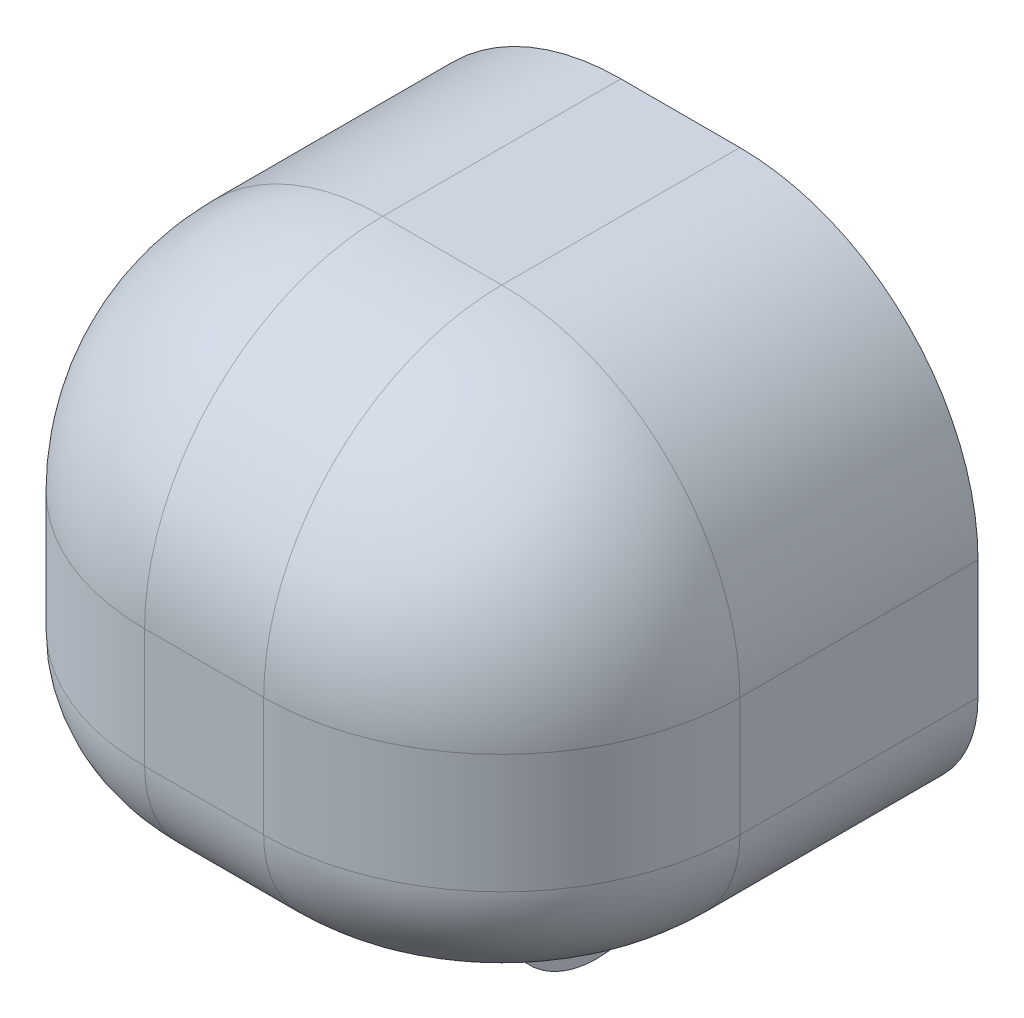
from build123d import *

# Parameters (mm, degrees)
SKETCH2_W           = 25
SKETCH2_H           = 25
BOSS_EXTRUDE1_DEPTH = 25
FILLET2_R           = 10
FILLET3_R           = 10
CUT_EXTRUDE1_START  = -5
SKETCH3_W           = 8
SKETCH3_H           = 8
SKETCH3_W_2         = 6
SKETCH3_H_2         = 6
CUT_EXTRUDE1_DEPTH  = 5
FILLET5_R           = 5
CUT_EXTRUDE2_DEPTH  = 5
FILLET6_R           = 4
SKETCH6_R           = 1.5
CUT_EXTRUDE3_DEPTH  = 15
CUT_EXTRUDE4_DEPTH  = 5


with BuildPart() as part:
    # Sketch2 → Boss-Extrude1 (new body)
    with BuildSketch(Plane(origin=(0, 0, 0), x_dir=(1, 0, 0), z_dir=(0, 1, 0))):
        Rectangle(SKETCH2_W, SKETCH2_H)
    extrude(amount=BOSS_EXTRUDE1_DEPTH)

    # Fillet2
    fillet2_edges = [part.edges().sort_by_distance(p)[0] for p in [
        (12.5, 12.5, 12.5),
        (-12.5, 12.5, 12.5),
    ]]
    fillet(fillet2_edges, radius=FILLET2_R)

    # Fillet3
    fillet3_edges = [part.edges().sort_by_distance(p)[0] for p in [
        (0, 25, 12.5),
        (12.5, 25, -5),
        (9.571067812, 25, 9.571067812),
        (-9.571067812, 25, 9.571067812),
        (-12.5, 25, -5),
    ]]
    fillet(fillet3_edges, radius=FILLET3_R)

    # Sketch3 → Cut-Extrude1 (cut)
    # profile 1 of 2: a face of its own
    with BuildSketch(Plane.XZ.offset(CUT_EXTRUDE1_START)):
        with BuildLine():
            ThreePointArc((12.5, 2.5), (9.571067812, 9.571067812), (2.5, 12.5))
            Line((2.5, 12.5), (-2.5, 12.5))
            ThreePointArc((-2.5, 12.5), (-9.571067812, 9.571067812), (-12.5, 2.5))
            Line((-12.5, 2.5), (-12.5, -12.5))
            Line((-12.5, -12.5), (12.5, -12.5))
            Line((12.5, -12.5), (12.5, 2.5))
        make_face()
        Rectangle(SKETCH3_W, SKETCH3_H, mode=Mode.SUBTRACT)
    # profile 2 of 2: a face of its own
    with BuildSketch(Plane.XZ.offset(CUT_EXTRUDE1_START)):
        Rectangle(SKETCH3_W_2, SKETCH3_H_2)
    extrude(amount=CUT_EXTRUDE1_DEPTH, mode=Mode.SUBTRACT)

    # Fillet5
    fillet5_edges = [part.edges().sort_by_distance(p)[0] for p in [
        (9.571067812, 5, 9.571067812),
        (12.5, 5, -5),
        (-12.5, 5, -5),
        (-9.571067812, 5, 9.571067812),
        (0, 5, 12.5),
    ]]
    fillet(fillet5_edges, radius=FILLET5_R)

    # Sketch5 → Cut-Extrude2 (cut)
    with BuildSketch(Plane.XZ):
        Polygon((-3, 3), (-3, 4.768124317), (3, 4.768124317), (3, -4.905831879), (-3, -4.905831879), align=None)
    extrude(amount=-CUT_EXTRUDE2_DEPTH, mode=Mode.SUBTRACT)

    # Fillet6
    fillet6_edges = [part.edges().sort_by_distance(p)[0] for p in [
        (3.5, 0, -4),
        (3.5, 0, 4),
        (-3.5, 0, -4),
        (-3.5, 0, 4),
    ]]
    fillet(fillet6_edges, radius=FILLET6_R - 0.0001)  # a hair under: the kernel refuses the full size

    # Sketch6 → Cut-Extrude3 (cut)
    with BuildSketch(Plane.ZY.offset(4)):
        with Locations((0, 3)):
            Circle(SKETCH6_R)
    extrude(amount=-CUT_EXTRUDE3_DEPTH, mode=Mode.SUBTRACT)

    # Sketch7 → Cut-Extrude4 (cut)
    with BuildSketch(Plane(origin=(0, 0, -12.5), x_dir=(-1, 0, 0), z_dir=(0, 0, -1))):
        with BuildLine():
            Line((-12.5, 15), (-12.5, 10))
            ThreePointArc((-12.5, 10), (-11.035533906, 6.464466094), (-7.5, 5))
            Line((-7.5, 5), (7.5, 5))
            ThreePointArc((7.5, 5), (11.035533906, 6.464466094), (12.5, 10))
            Line((12.5, 10), (12.5, 15))
            ThreePointArc((12.5, 15), (9.571067812, 22.071067812), (2.5, 25))
            Line((2.5, 25), (-2.5, 25))
            ThreePointArc((-2.5, 25), (-9.571067812, 22.071067812), (-12.5, 15))
        make_face()
    extrude(amount=-CUT_EXTRUDE4_DEPTH, mode=Mode.SUBTRACT)


solid = part.part
